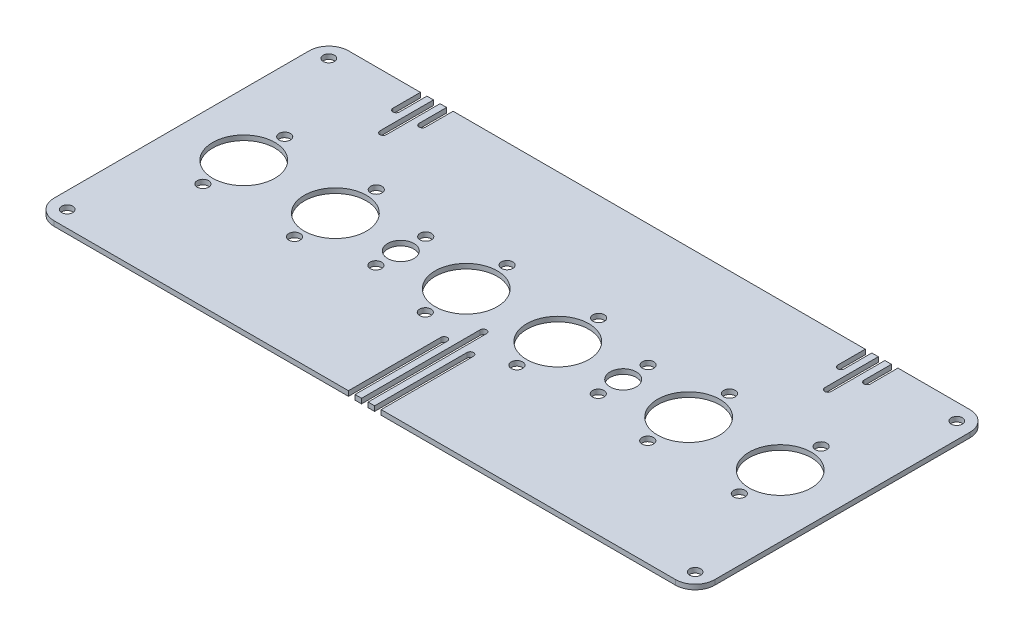
from build123d import *

# Parameters (mm, degrees)
ESQUISSE1_W             = 202
ESQUISSE1_H             = 90
BOSS_EXTRU_1_DEPTH      = 1.5
ENL_V_MAT_EXTRU_1_REACH = 223.148
ESQUISSE2_R             = 9.5
ESQUISSE2_R_2           = 4
ESQUISSE2_R_3           = 1.75
D_GAGEMENT_M31_D        = 3.4
CONG_1_R                = 6
ENL_V_MAT_EXTRU_3_REACH = 223.148


with BuildPart() as part:
    # Esquisse1 → Boss.-Extru.1 (new body)
    with BuildSketch(Plane(origin=(0, 0, 0), x_dir=(1, 0, 0), z_dir=(0, 1, 0))):
        with Locations((101, -45)):
            Rectangle(ESQUISSE1_W, ESQUISSE1_H)
    extrude(amount=BOSS_EXTRU_1_DEPTH)

    # Esquisse2 → Enlèv. mat.-Extru.1 (cut, up to next)
    with BuildSketch(Plane(origin=(0, 1.5, 0), x_dir=(1, 0, 0), z_dir=(0, 1, 0)), mode=Mode.PRIVATE) as enl_v_mat_extru_1_sk1:
        with Locations((115, -45)):
            Circle(ESQUISSE2_R)
    enl_v_mat_extru_1_tool1 = extrude(enl_v_mat_extru_1_sk1.sketch, amount=-ENL_V_MAT_EXTRU_1_REACH, mode=Mode.PRIVATE) & part.part
    # Esquisse2 → Enlèv. mat.-Extru.1 (cut, up to next)
    with BuildSketch(Plane(origin=(0, 1.5, 0), x_dir=(1, 0, 0), z_dir=(0, 1, 0)), mode=Mode.PRIVATE) as enl_v_mat_extru_1_sk2:
        with Locations((87, -45)):
            Circle(ESQUISSE2_R)
    enl_v_mat_extru_1_tool2 = extrude(enl_v_mat_extru_1_sk2.sketch, amount=-ENL_V_MAT_EXTRU_1_REACH, mode=Mode.PRIVATE) & part.part
    # Esquisse2 → Enlèv. mat.-Extru.1 (cut, up to next)
    with BuildSketch(Plane(origin=(0, 1.5, 0), x_dir=(1, 0, 0), z_dir=(0, 1, 0)), mode=Mode.PRIVATE) as enl_v_mat_extru_1_sk3:
        with Locations((155, -45)):
            Circle(ESQUISSE2_R)
    enl_v_mat_extru_1_tool3 = extrude(enl_v_mat_extru_1_sk3.sketch, amount=-ENL_V_MAT_EXTRU_1_REACH, mode=Mode.PRIVATE) & part.part
    # Esquisse2 → Enlèv. mat.-Extru.1 (cut, up to next)
    with BuildSketch(Plane(origin=(0, 1.5, 0), x_dir=(1, 0, 0), z_dir=(0, 1, 0)), mode=Mode.PRIVATE) as enl_v_mat_extru_1_sk4:
        with Locations((183, -45)):
            Circle(ESQUISSE2_R)
    enl_v_mat_extru_1_tool4 = extrude(enl_v_mat_extru_1_sk4.sketch, amount=-ENL_V_MAT_EXTRU_1_REACH, mode=Mode.PRIVATE) & part.part
    # Esquisse2 → Enlèv. mat.-Extru.1 (cut, up to next)
    with BuildSketch(Plane(origin=(0, 1.5, 0), x_dir=(1, 0, 0), z_dir=(0, 1, 0)), mode=Mode.PRIVATE) as enl_v_mat_extru_1_sk5:
        with Locations((47, -45)):
            Circle(ESQUISSE2_R)
    enl_v_mat_extru_1_tool5 = extrude(enl_v_mat_extru_1_sk5.sketch, amount=-ENL_V_MAT_EXTRU_1_REACH, mode=Mode.PRIVATE) & part.part
    # Esquisse2 → Enlèv. mat.-Extru.1 (cut, up to next)
    with BuildSketch(Plane(origin=(0, 1.5, 0), x_dir=(1, 0, 0), z_dir=(0, 1, 0)), mode=Mode.PRIVATE) as enl_v_mat_extru_1_sk6:
        with Locations((19, -45)):
            Circle(ESQUISSE2_R)
    enl_v_mat_extru_1_tool6 = extrude(enl_v_mat_extru_1_sk6.sketch, amount=-ENL_V_MAT_EXTRU_1_REACH, mode=Mode.PRIVATE) & part.part
    # Esquisse2 → Enlèv. mat.-Extru.1 (cut, up to next)
    with BuildSketch(Plane(origin=(0, 1.5, 0), x_dir=(1, 0, 0), z_dir=(0, 1, 0)), mode=Mode.PRIVATE) as enl_v_mat_extru_1_sk7:
        with Locations((67, -45)):
            Circle(ESQUISSE2_R_2)
    enl_v_mat_extru_1_tool7 = extrude(enl_v_mat_extru_1_sk7.sketch, amount=-ENL_V_MAT_EXTRU_1_REACH, mode=Mode.PRIVATE) & part.part
    # Esquisse2 → Enlèv. mat.-Extru.1 (cut, up to next)
    with BuildSketch(Plane(origin=(0, 1.5, 0), x_dir=(1, 0, 0), z_dir=(0, 1, 0)), mode=Mode.PRIVATE) as enl_v_mat_extru_1_sk8:
        with Locations((135, -45)):
            Circle(ESQUISSE2_R_2)
    enl_v_mat_extru_1_tool8 = extrude(enl_v_mat_extru_1_sk8.sketch, amount=-ENL_V_MAT_EXTRU_1_REACH, mode=Mode.PRIVATE) & part.part
    # Esquisse2 → Enlèv. mat.-Extru.1 (cut, up to next)
    with BuildSketch(Plane(origin=(0, 1.5, 0), x_dir=(1, 0, 0), z_dir=(0, 1, 0)), mode=Mode.PRIVATE) as enl_v_mat_extru_1_sk9:
        with Locations((19, -57.5)):
            Circle(ESQUISSE2_R_3)
    enl_v_mat_extru_1_tool9 = extrude(enl_v_mat_extru_1_sk9.sketch, amount=-ENL_V_MAT_EXTRU_1_REACH, mode=Mode.PRIVATE) & part.part
    # Esquisse2 → Enlèv. mat.-Extru.1 (cut, up to next)
    with BuildSketch(Plane(origin=(0, 1.5, 0), x_dir=(1, 0, 0), z_dir=(0, 1, 0)), mode=Mode.PRIVATE) as enl_v_mat_extru_1_sk10:
        with Locations((19, -32.5)):
            Circle(ESQUISSE2_R_3)
    enl_v_mat_extru_1_tool10 = extrude(enl_v_mat_extru_1_sk10.sketch, amount=-ENL_V_MAT_EXTRU_1_REACH, mode=Mode.PRIVATE) & part.part
    # Esquisse2 → Enlèv. mat.-Extru.1 (cut, up to next)
    with BuildSketch(Plane(origin=(0, 1.5, 0), x_dir=(1, 0, 0), z_dir=(0, 1, 0)), mode=Mode.PRIVATE) as enl_v_mat_extru_1_sk11:
        with Locations((47, -57.5)):
            Circle(ESQUISSE2_R_3)
    enl_v_mat_extru_1_tool11 = extrude(enl_v_mat_extru_1_sk11.sketch, amount=-ENL_V_MAT_EXTRU_1_REACH, mode=Mode.PRIVATE) & part.part
    # Esquisse2 → Enlèv. mat.-Extru.1 (cut, up to next)
    with BuildSketch(Plane(origin=(0, 1.5, 0), x_dir=(1, 0, 0), z_dir=(0, 1, 0)), mode=Mode.PRIVATE) as enl_v_mat_extru_1_sk12:
        with Locations((47, -32.5)):
            Circle(ESQUISSE2_R_3)
    enl_v_mat_extru_1_tool12 = extrude(enl_v_mat_extru_1_sk12.sketch, amount=-ENL_V_MAT_EXTRU_1_REACH, mode=Mode.PRIVATE) & part.part
    # Esquisse2 → Enlèv. mat.-Extru.1 (cut, up to next)
    with BuildSketch(Plane(origin=(0, 1.5, 0), x_dir=(1, 0, 0), z_dir=(0, 1, 0)), mode=Mode.PRIVATE) as enl_v_mat_extru_1_sk13:
        with Locations((87, -57.5)):
            Circle(ESQUISSE2_R_3)
    enl_v_mat_extru_1_tool13 = extrude(enl_v_mat_extru_1_sk13.sketch, amount=-ENL_V_MAT_EXTRU_1_REACH, mode=Mode.PRIVATE) & part.part
    # Esquisse2 → Enlèv. mat.-Extru.1 (cut, up to next)
    with BuildSketch(Plane(origin=(0, 1.5, 0), x_dir=(1, 0, 0), z_dir=(0, 1, 0)), mode=Mode.PRIVATE) as enl_v_mat_extru_1_sk14:
        with Locations((87, -32.5)):
            Circle(ESQUISSE2_R_3)
    enl_v_mat_extru_1_tool14 = extrude(enl_v_mat_extru_1_sk14.sketch, amount=-ENL_V_MAT_EXTRU_1_REACH, mode=Mode.PRIVATE) & part.part
    # Esquisse2 → Enlèv. mat.-Extru.1 (cut, up to next)
    with BuildSketch(Plane(origin=(0, 1.5, 0), x_dir=(1, 0, 0), z_dir=(0, 1, 0)), mode=Mode.PRIVATE) as enl_v_mat_extru_1_sk15:
        with Locations((115, -32.5)):
            Circle(ESQUISSE2_R_3)
    enl_v_mat_extru_1_tool15 = extrude(enl_v_mat_extru_1_sk15.sketch, amount=-ENL_V_MAT_EXTRU_1_REACH, mode=Mode.PRIVATE) & part.part
    # Esquisse2 → Enlèv. mat.-Extru.1 (cut, up to next)
    with BuildSketch(Plane(origin=(0, 1.5, 0), x_dir=(1, 0, 0), z_dir=(0, 1, 0)), mode=Mode.PRIVATE) as enl_v_mat_extru_1_sk16:
        with Locations((115, -57.5)):
            Circle(ESQUISSE2_R_3)
    enl_v_mat_extru_1_tool16 = extrude(enl_v_mat_extru_1_sk16.sketch, amount=-ENL_V_MAT_EXTRU_1_REACH, mode=Mode.PRIVATE) & part.part
    # Esquisse2 → Enlèv. mat.-Extru.1 (cut, up to next)
    with BuildSketch(Plane(origin=(0, 1.5, 0), x_dir=(1, 0, 0), z_dir=(0, 1, 0)), mode=Mode.PRIVATE) as enl_v_mat_extru_1_sk17:
        with Locations((155, -57.5)):
            Circle(ESQUISSE2_R_3)
    enl_v_mat_extru_1_tool17 = extrude(enl_v_mat_extru_1_sk17.sketch, amount=-ENL_V_MAT_EXTRU_1_REACH, mode=Mode.PRIVATE) & part.part
    # Esquisse2 → Enlèv. mat.-Extru.1 (cut, up to next)
    with BuildSketch(Plane(origin=(0, 1.5, 0), x_dir=(1, 0, 0), z_dir=(0, 1, 0)), mode=Mode.PRIVATE) as enl_v_mat_extru_1_sk18:
        with Locations((155, -32.5)):
            Circle(ESQUISSE2_R_3)
    enl_v_mat_extru_1_tool18 = extrude(enl_v_mat_extru_1_sk18.sketch, amount=-ENL_V_MAT_EXTRU_1_REACH, mode=Mode.PRIVATE) & part.part
    # Esquisse2 → Enlèv. mat.-Extru.1 (cut, up to next)
    with BuildSketch(Plane(origin=(0, 1.5, 0), x_dir=(1, 0, 0), z_dir=(0, 1, 0)), mode=Mode.PRIVATE) as enl_v_mat_extru_1_sk19:
        with Locations((183, -32.5)):
            Circle(ESQUISSE2_R_3)
    enl_v_mat_extru_1_tool19 = extrude(enl_v_mat_extru_1_sk19.sketch, amount=-ENL_V_MAT_EXTRU_1_REACH, mode=Mode.PRIVATE) & part.part
    # Esquisse2 → Enlèv. mat.-Extru.1 (cut, up to next)
    with BuildSketch(Plane(origin=(0, 1.5, 0), x_dir=(1, 0, 0), z_dir=(0, 1, 0)), mode=Mode.PRIVATE) as enl_v_mat_extru_1_sk20:
        with Locations((183, -57.5)):
            Circle(ESQUISSE2_R_3)
    enl_v_mat_extru_1_tool20 = extrude(enl_v_mat_extru_1_sk20.sketch, amount=-ENL_V_MAT_EXTRU_1_REACH, mode=Mode.PRIVATE) & part.part
    # Esquisse2 → Enlèv. mat.-Extru.1 (cut, up to next)
    with BuildSketch(Plane(origin=(0, 1.5, 0), x_dir=(1, 0, 0), z_dir=(0, 1, 0)), mode=Mode.PRIVATE) as enl_v_mat_extru_1_sk21:
        with Locations((67, -52.62)):
            Circle(ESQUISSE2_R_3)
    enl_v_mat_extru_1_tool21 = extrude(enl_v_mat_extru_1_sk21.sketch, amount=-ENL_V_MAT_EXTRU_1_REACH, mode=Mode.PRIVATE) & part.part
    # Esquisse2 → Enlèv. mat.-Extru.1 (cut, up to next)
    with BuildSketch(Plane(origin=(0, 1.5, 0), x_dir=(1, 0, 0), z_dir=(0, 1, 0)), mode=Mode.PRIVATE) as enl_v_mat_extru_1_sk22:
        with Locations((67, -37.38)):
            Circle(ESQUISSE2_R_3)
    enl_v_mat_extru_1_tool22 = extrude(enl_v_mat_extru_1_sk22.sketch, amount=-ENL_V_MAT_EXTRU_1_REACH, mode=Mode.PRIVATE) & part.part
    # Esquisse2 → Enlèv. mat.-Extru.1 (cut, up to next)
    with BuildSketch(Plane(origin=(0, 1.5, 0), x_dir=(1, 0, 0), z_dir=(0, 1, 0)), mode=Mode.PRIVATE) as enl_v_mat_extru_1_sk23:
        with Locations((135, -37.38)):
            Circle(ESQUISSE2_R_3)
    enl_v_mat_extru_1_tool23 = extrude(enl_v_mat_extru_1_sk23.sketch, amount=-ENL_V_MAT_EXTRU_1_REACH, mode=Mode.PRIVATE) & part.part
    # Esquisse2 → Enlèv. mat.-Extru.1 (cut, up to next)
    with BuildSketch(Plane(origin=(0, 1.5, 0), x_dir=(1, 0, 0), z_dir=(0, 1, 0)), mode=Mode.PRIVATE) as enl_v_mat_extru_1_sk24:
        with Locations((135, -52.62)):
            Circle(ESQUISSE2_R_3)
    enl_v_mat_extru_1_tool24 = extrude(enl_v_mat_extru_1_sk24.sketch, amount=-ENL_V_MAT_EXTRU_1_REACH, mode=Mode.PRIVATE) & part.part
    add(enl_v_mat_extru_1_tool1.solids().sort_by_distance((115, 1.5, 45))[0], mode=Mode.SUBTRACT)
    add(enl_v_mat_extru_1_tool2.solids().sort_by_distance((87, 1.5, 45))[0], mode=Mode.SUBTRACT)
    add(enl_v_mat_extru_1_tool3.solids().sort_by_distance((155, 1.5, 45))[0], mode=Mode.SUBTRACT)
    add(enl_v_mat_extru_1_tool4.solids().sort_by_distance((183, 1.5, 45))[0], mode=Mode.SUBTRACT)
    add(enl_v_mat_extru_1_tool5.solids().sort_by_distance((47, 1.5, 45))[0], mode=Mode.SUBTRACT)
    add(enl_v_mat_extru_1_tool6.solids().sort_by_distance((19, 1.5, 45))[0], mode=Mode.SUBTRACT)
    add(enl_v_mat_extru_1_tool7.solids().sort_by_distance((67, 1.5, 45))[0], mode=Mode.SUBTRACT)
    add(enl_v_mat_extru_1_tool8.solids().sort_by_distance((135, 1.5, 45))[0], mode=Mode.SUBTRACT)
    add(enl_v_mat_extru_1_tool9.solids().sort_by_distance((19, 1.5, 57.5))[0], mode=Mode.SUBTRACT)
    add(enl_v_mat_extru_1_tool10.solids().sort_by_distance((19, 1.5, 32.5))[0], mode=Mode.SUBTRACT)
    add(enl_v_mat_extru_1_tool11.solids().sort_by_distance((47, 1.5, 57.5))[0], mode=Mode.SUBTRACT)
    add(enl_v_mat_extru_1_tool12.solids().sort_by_distance((47, 1.5, 32.5))[0], mode=Mode.SUBTRACT)
    add(enl_v_mat_extru_1_tool13.solids().sort_by_distance((87, 1.5, 57.5))[0], mode=Mode.SUBTRACT)
    add(enl_v_mat_extru_1_tool14.solids().sort_by_distance((87, 1.5, 32.5))[0], mode=Mode.SUBTRACT)
    add(enl_v_mat_extru_1_tool15.solids().sort_by_distance((115, 1.5, 32.5))[0], mode=Mode.SUBTRACT)
    add(enl_v_mat_extru_1_tool16.solids().sort_by_distance((115, 1.5, 57.5))[0], mode=Mode.SUBTRACT)
    add(enl_v_mat_extru_1_tool17.solids().sort_by_distance((155, 1.5, 57.5))[0], mode=Mode.SUBTRACT)
    add(enl_v_mat_extru_1_tool18.solids().sort_by_distance((155, 1.5, 32.5))[0], mode=Mode.SUBTRACT)
    add(enl_v_mat_extru_1_tool19.solids().sort_by_distance((183, 1.5, 32.5))[0], mode=Mode.SUBTRACT)
    add(enl_v_mat_extru_1_tool20.solids().sort_by_distance((183, 1.5, 57.5))[0], mode=Mode.SUBTRACT)
    add(enl_v_mat_extru_1_tool21.solids().sort_by_distance((67, 1.5, 52.62))[0], mode=Mode.SUBTRACT)
    add(enl_v_mat_extru_1_tool22.solids().sort_by_distance((67, 1.5, 37.38))[0], mode=Mode.SUBTRACT)
    add(enl_v_mat_extru_1_tool23.solids().sort_by_distance((135, 1.5, 37.38))[0], mode=Mode.SUBTRACT)
    add(enl_v_mat_extru_1_tool24.solids().sort_by_distance((135, 1.5, 52.62))[0], mode=Mode.SUBTRACT)

    # Dégagement M31 (through all)
    with Locations(Plane(origin=(0, 0, 0), x_dir=(-1, 0, 0), z_dir=(0, -1, 0))):
        with Locations((-5, -85), (-5, -5), (-197, -5), (-197, -85)):
            Hole(D_GAGEMENT_M31_D / 2)

    # Congé1
    cong_1_edges = [part.edges().sort_by_distance(p)[0] for p in [
        (202, 0.75, 90),
        (0, 0.75, 90),
        (0, 0.75, 0),
        (202, 0.75, 0),
    ]]
    fillet(cong_1_edges, radius=CONG_1_R)

    # Esquisse6 → Enlèv. mat.-Extru.3 (cut, up to next)
    with BuildSketch(Plane(origin=(0, 1.5, 0), x_dir=(1, 0, 0), z_dir=(0, 1, 0)), mode=Mode.PRIVATE) as enl_v_mat_extru_3_sk1:
        with BuildLine():
            Line((100, -90), (102, -90))
            Line((102, -90), (102, -53.763853049))
            ThreePointArc((102, -53.763853049), (101, -52.763853049), (100, -53.763853049))
            Line((100, -53.763853049), (100, -90))
        make_face()
    enl_v_mat_extru_3_tool1 = extrude(enl_v_mat_extru_3_sk1.sketch, amount=-ENL_V_MAT_EXTRU_3_REACH, mode=Mode.PRIVATE) & part.part
    # Esquisse6 → Enlèv. mat.-Extru.3 (cut, up to next)
    with BuildSketch(Plane(origin=(0, 1.5, 0), x_dir=(1, 0, 0), z_dir=(0, 1, 0)), mode=Mode.PRIVATE) as enl_v_mat_extru_3_sk2:
        with BuildLine():
            Line((96, -61.763853049), (96, -90))
            Line((96, -90), (98, -90))
            Line((98, -90), (98, -61.763853049))
            ThreePointArc((98, -61.763853049), (97, -60.763853049), (96, -61.763853049))
        make_face()
    enl_v_mat_extru_3_tool2 = extrude(enl_v_mat_extru_3_sk2.sketch, amount=-ENL_V_MAT_EXTRU_3_REACH, mode=Mode.PRIVATE) & part.part
    # Esquisse6 → Enlèv. mat.-Extru.3 (cut, up to next)
    with BuildSketch(Plane(origin=(0, 1.5, 0), x_dir=(1, 0, 0), z_dir=(0, 1, 0)), mode=Mode.PRIVATE) as enl_v_mat_extru_3_sk3:
        with BuildLine():
            Line((104, -61.763853049), (104, -90))
            Line((104, -90), (106, -90))
            Line((106, -90), (106, -61.763853049))
            ThreePointArc((106, -61.763853049), (105, -60.763853049), (104, -61.763853049))
        make_face()
    enl_v_mat_extru_3_tool3 = extrude(enl_v_mat_extru_3_sk3.sketch, amount=-ENL_V_MAT_EXTRU_3_REACH, mode=Mode.PRIVATE) & part.part
    # Esquisse6 → Enlèv. mat.-Extru.3 (cut, up to next)
    with BuildSketch(Plane(origin=(0, 1.5, 0), x_dir=(1, 0, 0), z_dir=(0, 1, 0)), mode=Mode.PRIVATE) as enl_v_mat_extru_3_sk4:
        with BuildLine():
            Line((32, 0), (34, 0))
            Line((34, 0), (34, -16.412224746))
            ThreePointArc((34, -16.412224746), (33, -17.412224746), (32, -16.412224746))
            Line((32, -16.412224746), (32, 0))
        make_face()
    enl_v_mat_extru_3_tool4 = extrude(enl_v_mat_extru_3_sk4.sketch, amount=-ENL_V_MAT_EXTRU_3_REACH, mode=Mode.PRIVATE) & part.part
    # Esquisse6 → Enlèv. mat.-Extru.3 (cut, up to next)
    with BuildSketch(Plane(origin=(0, 1.5, 0), x_dir=(1, 0, 0), z_dir=(0, 1, 0)), mode=Mode.PRIVATE) as enl_v_mat_extru_3_sk5:
        with BuildLine():
            Line((36, 0), (38, 0))
            Line((38, 0), (38, -8.412224746))
            ThreePointArc((38, -8.412224746), (37, -9.412224746), (36, -8.412224746))
            Line((36, -8.412224746), (36, 0))
        make_face()
    enl_v_mat_extru_3_tool5 = extrude(enl_v_mat_extru_3_sk5.sketch, amount=-ENL_V_MAT_EXTRU_3_REACH, mode=Mode.PRIVATE) & part.part
    # Esquisse6 → Enlèv. mat.-Extru.3 (cut, up to next)
    with BuildSketch(Plane(origin=(0, 1.5, 0), x_dir=(1, 0, 0), z_dir=(0, 1, 0)), mode=Mode.PRIVATE) as enl_v_mat_extru_3_sk6:
        with BuildLine():
            Line((28, 0), (30, 0))
            Line((30, 0), (30, -8.412224746))
            ThreePointArc((30, -8.412224746), (29, -9.412224746), (28, -8.412224746))
            Line((28, -8.412224746), (28, 0))
        make_face()
    enl_v_mat_extru_3_tool6 = extrude(enl_v_mat_extru_3_sk6.sketch, amount=-ENL_V_MAT_EXTRU_3_REACH, mode=Mode.PRIVATE) & part.part
    # Esquisse6 → Enlèv. mat.-Extru.3 (cut, up to next)
    with BuildSketch(Plane(origin=(0, 1.5, 0), x_dir=(1, 0, 0), z_dir=(0, 1, 0)), mode=Mode.PRIVATE) as enl_v_mat_extru_3_sk7:
        with BuildLine():
            Line((168, 0), (170, 0))
            Line((170, 0), (170, -16.412224746))
            ThreePointArc((170, -16.412224746), (169, -17.412224746), (168, -16.412224746))
            Line((168, -16.412224746), (168, 0))
        make_face()
    enl_v_mat_extru_3_tool7 = extrude(enl_v_mat_extru_3_sk7.sketch, amount=-ENL_V_MAT_EXTRU_3_REACH, mode=Mode.PRIVATE) & part.part
    # Esquisse6 → Enlèv. mat.-Extru.3 (cut, up to next)
    with BuildSketch(Plane(origin=(0, 1.5, 0), x_dir=(1, 0, 0), z_dir=(0, 1, 0)), mode=Mode.PRIVATE) as enl_v_mat_extru_3_sk8:
        with BuildLine():
            Line((172, 0), (174, 0))
            Line((174, 0), (174, -8.412224746))
            ThreePointArc((174, -8.412224746), (173, -9.412224746), (172, -8.412224746))
            Line((172, -8.412224746), (172, 0))
        make_face()
    enl_v_mat_extru_3_tool8 = extrude(enl_v_mat_extru_3_sk8.sketch, amount=-ENL_V_MAT_EXTRU_3_REACH, mode=Mode.PRIVATE) & part.part
    # Esquisse6 → Enlèv. mat.-Extru.3 (cut, up to next)
    with BuildSketch(Plane(origin=(0, 1.5, 0), x_dir=(1, 0, 0), z_dir=(0, 1, 0)), mode=Mode.PRIVATE) as enl_v_mat_extru_3_sk9:
        with BuildLine():
            Line((164, 0), (166, 0))
            Line((166, 0), (166, -8.412224746))
            ThreePointArc((166, -8.412224746), (165, -9.412224746), (164, -8.412224746))
            Line((164, -8.412224746), (164, 0))
        make_face()
    enl_v_mat_extru_3_tool9 = extrude(enl_v_mat_extru_3_sk9.sketch, amount=-ENL_V_MAT_EXTRU_3_REACH, mode=Mode.PRIVATE) & part.part
    add(enl_v_mat_extru_3_tool1.solids().sort_by_distance((101, 1.5, 71.488555))[0], mode=Mode.SUBTRACT)
    add(enl_v_mat_extru_3_tool2.solids().sort_by_distance((97, 1.5, 75.488369))[0], mode=Mode.SUBTRACT)
    add(enl_v_mat_extru_3_tool3.solids().sort_by_distance((105, 1.5, 75.488369))[0], mode=Mode.SUBTRACT)
    add(enl_v_mat_extru_3_tool4.solids().sort_by_distance((33, 1.5, 8.60026))[0], mode=Mode.SUBTRACT)
    add(enl_v_mat_extru_3_tool5.solids().sort_by_distance((37, 1.5, 4.60152))[0], mode=Mode.SUBTRACT)
    add(enl_v_mat_extru_3_tool6.solids().sort_by_distance((29, 1.5, 4.60152))[0], mode=Mode.SUBTRACT)
    add(enl_v_mat_extru_3_tool7.solids().sort_by_distance((169, 1.5, 8.60026))[0], mode=Mode.SUBTRACT)
    add(enl_v_mat_extru_3_tool8.solids().sort_by_distance((173, 1.5, 4.60152))[0], mode=Mode.SUBTRACT)
    add(enl_v_mat_extru_3_tool9.solids().sort_by_distance((165, 1.5, 4.60152))[0], mode=Mode.SUBTRACT)


solid = part.part
